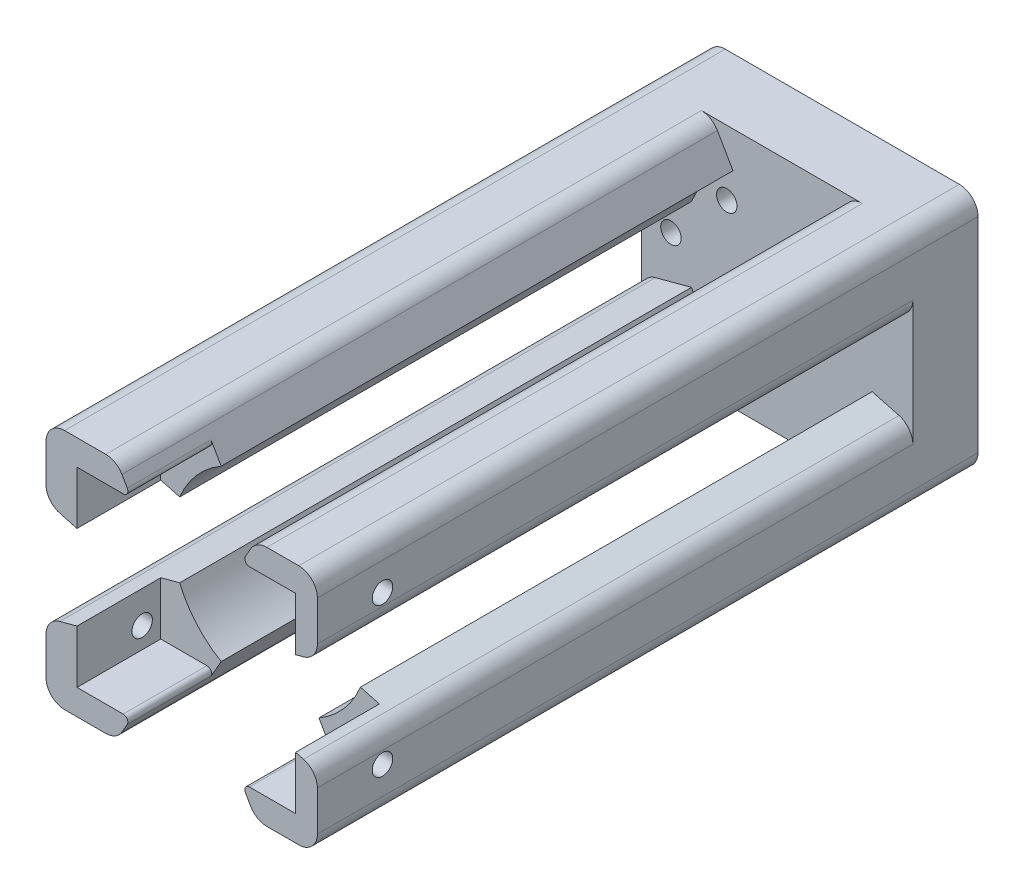
from build123d import *
from build123d.topology import SkipClean

# Parameters (mm, degrees)
SKETCH_1_R               = 15
EXTRUDE_1_DEPTH          = 59
SKETCH_2_R               = 1.1
CUT_EXTRUDE_1_DEPTH      = 10
SKETCH_3_W               = 28.98
SKETCH_3_H               = 25.98
SKETCH_3_W_2             = 23.5
SKETCH_3_H_2             = 20.5
EXTRUDE_2_DEPTH          = 9
CUT_EXTRUDE_2_DEPTH      = 55
SKETCH_6_W               = 28.98
SKETCH_6_H               = 25.98
EXTRUDE_6_DEPTH          = 5
CUT_EXTRUDE_3_REACH      = 77.622
SKETCH_7_R               = 1.1
SKETCH_10_R              = 0.8
CUT_EXTRUDE_4_DEPTH      = 68.424031324
CUT_EXTRUDE_5_DEPTH      = 59.017238817
FILLET_1_R               = 0.5
EXTRUDE_7_DEPTH          = 50
SKETCH_17_W              = 0.407540604
SKETCH_17_H              = 25.98
CUT_EXTRUDE_7_DEPTH      = 59.017238817
FILLET_3_R               = 2
CUT_EXTRUDE_6_DEPTH      = 59.017238817
PATTERN_CIRCULAR_4_COUNT = 4
BOSS_EXTRUDE1_START      = 54
BOSS_EXTRUDE1_DEPTH      = 54
CUT_EXTRUDE1_DEPTH       = 72.232015274
SKETCH4_R                = 10
SKETCH4_R_2              = 0.8
BOSS_EXTRUDE2_DEPTH      = 3
FILLET1_R                = 2
SKETCH5_R                = 0.8
BOSS_EXTRUDE3_DEPTH      = 7
BOSS_EXTRUDE4_START      = -7
SKETCH7_R                = 10
BOSS_EXTRUDE4_DEPTH      = 7
SKETCH11_W               = 3
SKETCH11_H               = 25.98
BOSS_EXTRUDE7_DEPTH      = 71
SKETCH6_R                = 1.1
CUT_EXTRUDE2_DEPTH       = 74.737512037
SKETCH8_R                = 10.5
CUT_EXTRUDE5_DEPTH       = 55
SKETCH9_R                = 8
CUT_EXTRUDE6_DEPTH       = 3
CUT_EXTRUDE7_DEPTH       = 64
SKETCH14_R               = 1.1
CUT_EXTRUDE8_DEPTH       = 29.164918793
FILLET2_R                = 2


with BuildPart() as part:
    # 草图1 → 凸台-拉伸1 (new body)
    with BuildSketch(Plane.XY):
        Circle(SKETCH_1_R)
    extrude(amount=EXTRUDE_1_DEPTH)

    # 草图2 → 切除-拉伸1 (cut)
    with BuildSketch(Plane(origin=(0, 0, 0), x_dir=(-1, 0, 0), z_dir=(0, 0, -1))):
        with Locations((0, 6)):
            Circle(SKETCH_2_R)
        with Locations(Location((0, -6, 0), (0, 0, 180))):
            Circle(SKETCH_2_R)
        with Locations((6, 0)):
            Circle(SKETCH_2_R)
        with Locations(Location((-6, 0, 0), (0, 0, 180))):
            Circle(SKETCH_2_R)
    extrude(amount=-CUT_EXTRUDE_1_DEPTH, mode=Mode.SUBTRACT)

    # 草图3 → 凸台-拉伸2 (add)
    with BuildSketch(Plane.XY.offset(59)):
        Rectangle(SKETCH_3_W, SKETCH_3_H)
        Rectangle(SKETCH_3_W_2, SKETCH_3_H_2, mode=Mode.SUBTRACT)
    extrude(amount=EXTRUDE_2_DEPTH)

    # 草图4 → 切除-拉伸2 (cut)
    with BuildSketch(Plane(origin=(0, 0, 4), x_dir=(-1, 0, 0), z_dir=(0, 0, -1))):
        with BuildLine():
            Line((-2.598076211, 4.5), (-7.5, 12.990381057))
            ThreePointArc((-7.5, 12.990381057), (0, 15), (7.5, 12.990381057))
            Line((7.5, 12.990381057), (2.598076211, 4.5))
            ThreePointArc((2.598076211, 4.5), (0, 3), (-2.598076211, 4.5))
        make_face()
        with BuildLine():
            Line((4.5, -2.598076211), (12.990381057, -7.5))
            ThreePointArc((12.990381057, -7.5), (15, 0), (12.990381057, 7.5))
            Line((12.990381057, 7.5), (4.5, 2.598076211))
            ThreePointArc((4.5, 2.598076211), (3, 0), (4.5, -2.598076211))
        make_face()
        with BuildLine():
            Line((-2.598076211, -4.5), (-7.5, -12.990381057))
            ThreePointArc((-7.5, -12.990381057), (0, -15), (7.5, -12.990381057))
            Line((7.5, -12.990381057), (2.598076211, -4.5))
            ThreePointArc((2.598076211, -4.5), (0, -3), (-2.598076211, -4.5))
        make_face()
        with BuildLine():
            Line((-4.5, 2.598076211), (-12.990381057, 7.5))
            ThreePointArc((-12.990381057, 7.5), (-15, 0), (-12.990381057, -7.5))
            Line((-12.990381057, -7.5), (-4.5, -2.598076211))
            ThreePointArc((-4.5, -2.598076211), (-3, 0), (-4.5, 2.598076211))
        make_face()
    extrude(amount=-CUT_EXTRUDE_2_DEPTH, mode=Mode.SUBTRACT)

    # 草图6 → 凸台-拉伸6 (add)
    with BuildSketch(Plane(origin=(0, 0, 59), x_dir=(-1, 0, 0), z_dir=(0, 0, -1))):
        Rectangle(SKETCH_6_W, SKETCH_6_H)
    extrude(amount=EXTRUDE_6_DEPTH)

    # 切除-拉伸3: up to this face of the body (flat: up to its plane)
    cut_extrude_3_end = Plane(part.part.faces().sort_by_distance((-14.49, 0, 61))[0])
    # 草图7 → 切除-拉伸3 (cut, up to the picked face)
    with BuildSketch(Plane(origin=(14.49, 0, 0), x_dir=(0, 0, -1), z_dir=(1, 0, 0)), mode=Mode.PRIVATE) as cut_extrude_3_sk1:
        with Locations(Location((-61, -8, 0), (0, 0, 90))):
            Circle(SKETCH_7_R)
    cut_extrude_3_tool1 = split(extrude(cut_extrude_3_sk1.sketch, amount=-CUT_EXTRUDE_3_REACH, mode=Mode.PRIVATE), bisect_by=cut_extrude_3_end, keep=Keep.BOTH, mode=Mode.PRIVATE)
    # 草图7 → 切除-拉伸3 (cut, up to the picked face)
    with BuildSketch(Plane(origin=(14.49, 0, 0), x_dir=(0, 0, -1), z_dir=(1, 0, 0)), mode=Mode.PRIVATE) as cut_extrude_3_sk2:
        with Locations(Location((-61, 8, 0), (0, 0, 90))):
            Circle(SKETCH_7_R)
    cut_extrude_3_tool2 = split(extrude(cut_extrude_3_sk2.sketch, amount=-CUT_EXTRUDE_3_REACH, mode=Mode.PRIVATE), bisect_by=cut_extrude_3_end, keep=Keep.BOTH, mode=Mode.PRIVATE)
    add(cut_extrude_3_tool1.solids().sort_by(Axis((14.49, -8, 61), (-1, 0, 0)))[0], mode=Mode.SUBTRACT)
    add(cut_extrude_3_tool2.solids().sort_by(Axis((14.49, 8, 61), (-1, 0, 0)))[0], mode=Mode.SUBTRACT)

    # 草图10 → 切除-拉伸4 (cut, through all)
    with BuildSketch(Plane.XY.offset(4)):
        with Locations((0, -12)):
            Circle(SKETCH_10_R)
    cut_extrude_4 = extrude(amount=-CUT_EXTRUDE_4_DEPTH, mode=Mode.SUBTRACT)

    # 草图11 → 切除-拉伸5 (cut, through all)
    with BuildSketch(Plane(origin=(0, 0, 54), x_dir=(-1, 0, 0), z_dir=(0, 0, -1))):
        with BuildLine():
            Line((2.598076211, 4.5), (7.499779997, 12.99))
            Line((7.499779997, 12.99), (-7.499779997, 12.99))
            Line((-7.499779997, 12.99), (-2.598076211, 4.5))
            ThreePointArc((-2.598076211, 4.5), (0, 3), (2.598076211, 4.5))
        make_face()
        with BuildLine():
            Line((-2.598076211, -4.5), (-7.499779997, -12.99))
            Line((-7.499779997, -12.99), (7.499779997, -12.99))
            Line((7.499779997, -12.99), (2.598076211, -4.5))
            ThreePointArc((2.598076211, -4.5), (0, -3), (-2.598076211, -4.5))
        make_face()
    extrude(amount=-CUT_EXTRUDE_5_DEPTH, mode=Mode.SUBTRACT)

    # 圆角1
    fillet_1_edges = [part.edges().sort_by_distance(p)[0] for p in [
        (5.917840259, 10.25, 63.5),
        (-5.917840259, 10.25, 63.5),
        (-5.917840259, -10.25, 63.5),
        (5.917840259, -10.25, 63.5),
    ]]
    fillet(fillet_1_edges, radius=FILLET_1_R)

    # 草图12 → 凸台-拉伸7 (add)
    with SkipClean():  # the faces are left unmerged after this step: merging them gives an invalid solid
        with BuildSketch(Plane.XY.offset(4)):
            with BuildLine():
                Line((-4.5, 2.598076211), (-14.082459396, 5.165688468))
                ThreePointArc((-14.082459396, 5.165688468), (-13.586645102, 6.356341311), (-12.990381057, 7.5))
                Line((-12.990381057, 7.5), (-4.5, 2.598076211))
            make_face()
            with BuildLine():
                Line((-12.990381057, -7.5), (-4.5, -2.598076211))
                Line((-4.5, -2.598076211), (-14.082459396, -5.165688468))
                ThreePointArc((-14.082459396, -5.165688468), (-13.586645102, -6.356341311), (-12.990381057, -7.5))
            make_face()
            with BuildLine():
                Line((4.5, -2.598076211), (14.082459396, -5.165688468))
                ThreePointArc((14.082459396, -5.165688468), (13.586645102, -6.356341311), (12.990381057, -7.5))
                Line((12.990381057, -7.5), (4.5, -2.598076211))
            make_face()
            with BuildLine():
                Line((4.5, 2.598076211), (12.990381057, 7.5))
                ThreePointArc((12.990381057, 7.5), (13.586645102, 6.356341311), (14.082459396, 5.165688468))
                Line((14.082459396, 5.165688468), (4.5, 2.598076211))
            make_face()
        extrude(amount=EXTRUDE_7_DEPTH)

    # 草图17 → 切除-拉伸7 (cut, through all)
    with SkipClean():  # the faces are left unmerged after this step: merging them gives an invalid solid
        with BuildSketch(Plane(origin=(0, 0, 54), x_dir=(-1, 0, 0), z_dir=(0, 0, -1))):
            with Locations((14.286229698, 0)):
                Rectangle(SKETCH_17_W, SKETCH_17_H)
            with Locations((-14.286229698, 0)):
                Rectangle(SKETCH_17_W, SKETCH_17_H)
        extrude(amount=-CUT_EXTRUDE_7_DEPTH, mode=Mode.SUBTRACT)

    # 圆角3
    fillet_3_edges = [part.edges().sort_by_distance(p)[0] for p in [
        (-14.082459396, -12.99, 61),
        (-14.082459396, 12.99, 61),
        (14.082459396, 12.99, 61),
        (14.082459396, -12.99, 61),
    ]]
    fillet(fillet_3_edges, radius=FILLET_3_R)

    # 草图13 → 切除-拉伸6 (cut, through all)
    with SkipClean():  # the faces are left unmerged after this step: merging them gives an invalid solid
        with BuildSketch(Plane(origin=(0, 0, 54), x_dir=(-1, 0, 0), z_dir=(0, 0, -1))):
            with BuildLine():
                Line((-4.5, -2.598076211), (-14.082459396, -5.165688468))
                Line((-14.082459396, -5.165688468), (-14.082459396, 5.165688468))
                Line((-14.082459396, 5.165688468), (-4.5, 2.598076211))
                ThreePointArc((-4.5, 2.598076211), (-3, 0), (-4.5, -2.598076211))
            make_face()
            with BuildLine():
                Line((14.082459396, 5.165688468), (14.082459396, -5.165688468))
                Line((14.082459396, -5.165688468), (4.5, -2.598076211))
                ThreePointArc((4.5, -2.598076211), (3, 0), (4.5, 2.598076211))
                Line((4.5, 2.598076211), (14.082459396, 5.165688468))
            make_face()
        extrude(amount=-CUT_EXTRUDE_6_DEPTH, mode=Mode.SUBTRACT)

    # 阵列(圆周)4: 切除-拉伸4 ×4 about axis
    with SkipClean():  # the faces are left unmerged after this step: merging them gives an invalid solid
        pattern_circular_4_axis = Axis((0, 0, 0), (0, 0, 1))
        for i in range(1, PATTERN_CIRCULAR_4_COUNT):
            add(cut_extrude_4.rotate(pattern_circular_4_axis, i * 360 / PATTERN_CIRCULAR_4_COUNT), mode=Mode.SUBTRACT)

    # Sketch1 → Boss-Extrude1 (add)
    with BuildSketch(Plane(origin=(0, 0, 54), x_dir=(-1, 0, 0), z_dir=(0, 0, -1)).offset(BOSS_EXTRUDE1_START)):
        with BuildLine():
            Line((7.500659971, -12.99), (12.082459396, -12.99))
            ThreePointArc((12.082459396, -12.99), (13.496672959, -12.404213562), (14.082459396, -10.99))
            Line((14.082459396, -10.99), (14.082459396, -5.165688468))
            ThreePointArc((14.082459396, -5.165688468), (11.478794499, -9.655945156), (7.500659971, -12.99))
        make_face()
        with BuildLine():
            Line((-14.082459396, -5.165688468), (-14.082459396, -10.99))
            ThreePointArc((-14.082459396, -10.99), (-13.496672959, -12.404213562), (-12.082459396, -12.99))
            Line((-12.082459396, -12.99), (-7.500659971, -12.99))
            ThreePointArc((-7.500659971, -12.99), (-11.478794499, -9.655945156), (-14.082459396, -5.165688468))
        make_face()
        with BuildLine():
            Line((-7.500659971, 12.99), (-12.082459396, 12.99))
            ThreePointArc((-12.082459396, 12.99), (-13.496672959, 12.404213562), (-14.082459396, 10.99))
            Line((-14.082459396, 10.99), (-14.082459396, 5.165688468))
            ThreePointArc((-14.082459396, 5.165688468), (-11.478794499, 9.655945156), (-7.500659971, 12.99))
        make_face()
        with BuildLine():
            Line((14.082459396, 5.165688468), (14.082459396, 10.99))
            ThreePointArc((14.082459396, 10.99), (13.496672959, 12.404213562), (12.082459396, 12.99))
            Line((12.082459396, 12.99), (7.500659971, 12.99))
            ThreePointArc((7.500659971, 12.99), (11.478794499, 9.655945156), (14.082459396, 5.165688468))
        make_face()
    extrude(amount=-BOSS_EXTRUDE1_DEPTH)

    # Sketch3 → Cut-Extrude1 (cut, through all)
    with BuildSketch(Plane(origin=(0, 0, 0), x_dir=(-1, 0, 0), z_dir=(0, 0, -1))):
        with BuildLine():
            Line((-7.500659971, 12.99), (7.500659971, 12.99))
            ThreePointArc((7.500659971, 12.99), (0, 15), (-7.500659971, 12.99))
        make_face()
        with BuildLine():
            Line((14.082459396, 5.165688468), (14.082459396, -5.165688468))
            ThreePointArc((14.082459396, -5.165688468), (15, 0), (14.082459396, 5.165688468))
        make_face()
        with BuildLine():
            Line((7.500659971, -12.99), (-7.500659971, -12.99))
            ThreePointArc((-7.500659971, -12.99), (0, -15), (7.500659971, -12.99))
        make_face()
        with BuildLine():
            Line((-14.082459396, -5.165688468), (-14.082459396, 5.165688468))
            ThreePointArc((-14.082459396, 5.165688468), (-15, 0), (-14.082459396, -5.165688468))
        make_face()
    extrude(amount=-CUT_EXTRUDE1_DEPTH, mode=Mode.SUBTRACT)

    # Sketch4 → Boss-Extrude2 (add)
    with BuildSketch(Plane(origin=(0, 0, 0), x_dir=(-1, 0, 0), z_dir=(0, 0, -1))):
        with BuildLine():
            Line((-14.082459396, 10.99), (-14.082459396, -10.99))
            ThreePointArc((-14.082459396, -10.99), (-13.496672959, -12.404213562), (-12.082459396, -12.99))
            Line((-12.082459396, -12.99), (12.082459396, -12.99))
            ThreePointArc((12.082459396, -12.99), (13.496672959, -12.404213562), (14.082459396, -10.99))
            Line((14.082459396, -10.99), (14.082459396, 10.99))
            ThreePointArc((14.082459396, 10.99), (13.496672959, 12.404213562), (12.082459396, 12.99))
            Line((12.082459396, 12.99), (-12.082459396, 12.99))
            ThreePointArc((-12.082459396, 12.99), (-13.496672959, 12.404213562), (-14.082459396, 10.99))
        make_face()
        Circle(SKETCH4_R, mode=Mode.SUBTRACT)
        with Locations(Location((0, -12, 0), (0, 0, 180))):
            Circle(SKETCH4_R_2, mode=Mode.SUBTRACT)
        with Locations(Location((12, 0, 0), (0, 0, 270))):
            Circle(SKETCH4_R_2, mode=Mode.SUBTRACT)
        with Locations(Location((-12, 0, 0), (0, 0, 90))):
            Circle(SKETCH4_R_2, mode=Mode.SUBTRACT)
        with Locations((0, 12)):
            Circle(SKETCH4_R_2, mode=Mode.SUBTRACT)
    extrude(amount=BOSS_EXTRUDE2_DEPTH)

    # Fillet1
    fillet1_edges = [part.edges().sort_by_distance(p)[0] for p in [
        (7.499779997, 12.99, 36),
        (-7.499779997, 12.99, 36),
        (-7.499779997, -12.99, 36),
        (7.499779997, -12.99, 36),
        (-14.082459396, -5.165688468, 36),
        (-14.082459396, 5.165688468, 36),
        (14.082459396, 5.165688468, 36),
        (14.082459396, -5.165688468, 36),
    ]]
    fillet(fillet1_edges, radius=FILLET1_R)

    # Sketch5 → Boss-Extrude3 (add)
    with BuildSketch(Plane.XY.offset(4)):
        with Locations((0, -12)):
            Circle(SKETCH5_R)
        with Locations((12, 0)):
            Circle(SKETCH5_R)
        with Locations((0, 12)):
            Circle(SKETCH5_R)
        with Locations((-12, 0)):
            Circle(SKETCH5_R)
    extrude(amount=-BOSS_EXTRUDE3_DEPTH)

    # Sketch7 → Boss-Extrude4 (add)
    with BuildSketch(Plane(origin=(0, 0, -3), x_dir=(-1, 0, 0), z_dir=(0, 0, -1)).offset(BOSS_EXTRUDE4_START)):
        Circle(SKETCH7_R)
    extrude(amount=BOSS_EXTRUDE4_DEPTH)

    # Sketch11 → Boss-Extrude7 (add)
    with BuildSketch(Plane(origin=(0, 0, -3), x_dir=(-1, 0, 0), z_dir=(0, 0, -1))):
        with Locations((13.582459396, 0)):
            Rectangle(SKETCH11_W, SKETCH11_H)
    extrude(amount=-BOSS_EXTRUDE7_DEPTH)

    # Sketch6 → Cut-Extrude2 (cut, through all)
    with BuildSketch(Plane(origin=(0, 0, -3), x_dir=(-1, 0, 0), z_dir=(0, 0, -1))):
        with Locations((11.917540604, 0)):
            Circle(SKETCH6_R)
        with Locations((5.917540604, 6)):
            Circle(SKETCH6_R)
        with Locations((5.917540604, -6)):
            Circle(SKETCH6_R)
        with Locations((-0.082459396, 0)):
            Circle(SKETCH6_R)
    extrude(amount=-CUT_EXTRUDE2_DEPTH, mode=Mode.SUBTRACT)

    # Sketch8 → Cut-Extrude5 (cut)
    with BuildSketch(Plane.XY.offset(59)):
        Circle(SKETCH8_R)
    extrude(amount=-CUT_EXTRUDE5_DEPTH, mode=Mode.SUBTRACT)

    # Sketch9 → Cut-Extrude6 (cut)
    with BuildSketch(Plane(origin=(0, 0, -3), x_dir=(-1, 0, 0), z_dir=(0, 0, -1))):
        with Locations((5.917540604, 0)):
            Circle(SKETCH9_R)
    extrude(amount=-CUT_EXTRUDE6_DEPTH, mode=Mode.SUBTRACT)

    # Sketch12 → Cut-Extrude7 (cut)
    with BuildSketch(Plane.XY.offset(68)):
        Polygon((-11.75, 4.540707856), (-15.082459396, 5.433637661), (-15.082459396, -5.433637661), (-11.75, -4.540707856), align=None)
    extrude(amount=-CUT_EXTRUDE7_DEPTH, mode=Mode.SUBTRACT)

    # Sketch14 → Cut-Extrude8 (cut)
    with BuildSketch(Plane(origin=(14.082459396, 0, 0), x_dir=(0, 0, -1), z_dir=(1, 0, 0))):
        with Locations((-61, 8)):
            Circle(SKETCH14_R)
        with Locations((-61, -8)):
            Circle(SKETCH14_R)
    extrude(amount=-CUT_EXTRUDE8_DEPTH, mode=Mode.SUBTRACT)

    # Fillet2
    # the kernel refuses this fillet: 2 mm, written as the material it takes off along each edge
    with BuildSketch(Plane(origin=(-15.082459396, -12.99, -8), x_dir=(0, 1, 0), z_dir=(0, 0, 1)), Plane(origin=(-15.082459396, 12.99, -8), x_dir=(1, 0, 0), z_dir=(0, 0, 1))) as fillet2_piece_1:
        with BuildLine():
            CenterArc((FILLET2_R, -FILLET2_R), FILLET2_R, 90, 90)
            Line((0, -FILLET2_R), (0, 0))
            Line((0, 0), (FILLET2_R, 0))
        make_face()
    extrude(amount=81, mode=Mode.SUBTRACT)
    with BuildSketch(Plane(origin=(-15.082459396, 5.433637661, 71.83663494), x_dir=(0.965925826289068, -0.2588190451025217, 0), z_dir=(0, 0, -1)), Plane(origin=(-15.082459396, -5.433637661, 71.83663494), x_dir=(0, -1, 0), z_dir=(0, 0, -1))) as fillet2_piece_2:
        with BuildLine():
            CenterArc((FILLET2_R * 0.767326987979, -FILLET2_R), FILLET2_R, 90, 75)
            Line((-FILLET2_R * 0.19859883831, -FILLET2_R * 0.741180954897), (0, 0))
            Line((0, 0), (FILLET2_R * 0.767326987979, 0))
        make_face()
    extrude(amount=67.83663494, mode=Mode.SUBTRACT)


solid = part.part
